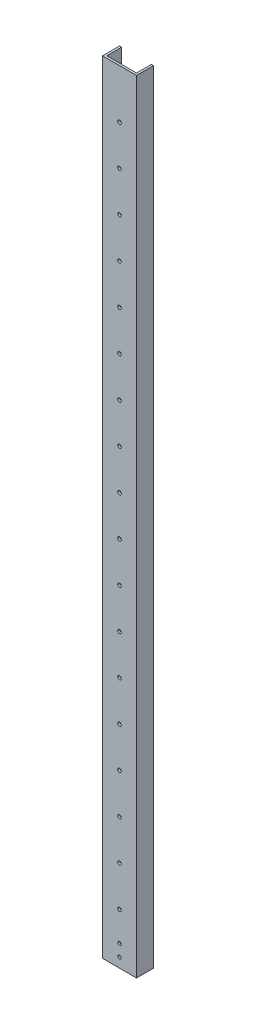
from build123d import *

# Parameters (mm, degrees)
BOSS_EXTRUDE1_DEPTH = 1168.4
CUT_EXTRUDE1_REACH  = 1171.78
SKETCH2_R           = 2.667
CUT_EXTRUDE2_REACH  = 1171.78
SKETCH3_R           = 2.5527


with BuildPart() as part:
    # Sketch1 → Boss-Extrude1 (new body)
    with BuildSketch(Plane(origin=(0, 0, 0), x_dir=(1, 0, 0), z_dir=(0, 1, 0))):
        Polygon((3.175, 3.175), (3.175, 25.4), (0, 25.4), (0, 0), (50.8, 0), (50.8, 25.4), (47.625, 25.4), (47.625, 3.175), align=None)
    extrude(amount=BOSS_EXTRUDE1_DEPTH)

    # Sketch2 → Cut-Extrude1 (cut, up to next)
    with BuildSketch(Plane.XY, mode=Mode.PRIVATE) as cut_extrude1_sk1:
        with Locations((25.4, 76.2)):
            Circle(SKETCH2_R)
    cut_extrude1_tool1 = extrude(cut_extrude1_sk1.sketch, amount=-CUT_EXTRUDE1_REACH, mode=Mode.PRIVATE) & part.part
    # Sketch2 → Cut-Extrude1 (cut, up to next)
    with BuildSketch(Plane.XY, mode=Mode.PRIVATE) as cut_extrude1_sk2:
        with Locations((25.4, 136.144)):
            Circle(SKETCH2_R)
    cut_extrude1_tool2 = extrude(cut_extrude1_sk2.sketch, amount=-CUT_EXTRUDE1_REACH, mode=Mode.PRIVATE) & part.part
    # Sketch2 → Cut-Extrude1 (cut, up to next)
    with BuildSketch(Plane.XY, mode=Mode.PRIVATE) as cut_extrude1_sk3:
        with Locations((25.4, 196.088)):
            Circle(SKETCH2_R)
    cut_extrude1_tool3 = extrude(cut_extrude1_sk3.sketch, amount=-CUT_EXTRUDE1_REACH, mode=Mode.PRIVATE) & part.part
    # Sketch2 → Cut-Extrude1 (cut, up to next)
    with BuildSketch(Plane.XY, mode=Mode.PRIVATE) as cut_extrude1_sk4:
        with Locations((25.4, 256.032)):
            Circle(SKETCH2_R)
    cut_extrude1_tool4 = extrude(cut_extrude1_sk4.sketch, amount=-CUT_EXTRUDE1_REACH, mode=Mode.PRIVATE) & part.part
    # Sketch2 → Cut-Extrude1 (cut, up to next)
    with BuildSketch(Plane.XY, mode=Mode.PRIVATE) as cut_extrude1_sk5:
        with Locations((25.4, 315.976)):
            Circle(SKETCH2_R)
    cut_extrude1_tool5 = extrude(cut_extrude1_sk5.sketch, amount=-CUT_EXTRUDE1_REACH, mode=Mode.PRIVATE) & part.part
    # Sketch2 → Cut-Extrude1 (cut, up to next)
    with BuildSketch(Plane.XY, mode=Mode.PRIVATE) as cut_extrude1_sk6:
        with Locations((25.4, 375.92)):
            Circle(SKETCH2_R)
    cut_extrude1_tool6 = extrude(cut_extrude1_sk6.sketch, amount=-CUT_EXTRUDE1_REACH, mode=Mode.PRIVATE) & part.part
    # Sketch2 → Cut-Extrude1 (cut, up to next)
    with BuildSketch(Plane.XY, mode=Mode.PRIVATE) as cut_extrude1_sk7:
        with Locations((25.4, 435.864)):
            Circle(SKETCH2_R)
    cut_extrude1_tool7 = extrude(cut_extrude1_sk7.sketch, amount=-CUT_EXTRUDE1_REACH, mode=Mode.PRIVATE) & part.part
    # Sketch2 → Cut-Extrude1 (cut, up to next)
    with BuildSketch(Plane.XY, mode=Mode.PRIVATE) as cut_extrude1_sk8:
        with Locations((25.4, 495.808)):
            Circle(SKETCH2_R)
    cut_extrude1_tool8 = extrude(cut_extrude1_sk8.sketch, amount=-CUT_EXTRUDE1_REACH, mode=Mode.PRIVATE) & part.part
    # Sketch2 → Cut-Extrude1 (cut, up to next)
    with BuildSketch(Plane.XY, mode=Mode.PRIVATE) as cut_extrude1_sk9:
        with Locations((25.4, 555.752)):
            Circle(SKETCH2_R)
    cut_extrude1_tool9 = extrude(cut_extrude1_sk9.sketch, amount=-CUT_EXTRUDE1_REACH, mode=Mode.PRIVATE) & part.part
    # Sketch2 → Cut-Extrude1 (cut, up to next)
    with BuildSketch(Plane.XY, mode=Mode.PRIVATE) as cut_extrude1_sk10:
        with Locations((25.4, 615.696)):
            Circle(SKETCH2_R)
    cut_extrude1_tool10 = extrude(cut_extrude1_sk10.sketch, amount=-CUT_EXTRUDE1_REACH, mode=Mode.PRIVATE) & part.part
    # Sketch2 → Cut-Extrude1 (cut, up to next)
    with BuildSketch(Plane.XY, mode=Mode.PRIVATE) as cut_extrude1_sk11:
        with Locations((25.4, 675.64)):
            Circle(SKETCH2_R)
    cut_extrude1_tool11 = extrude(cut_extrude1_sk11.sketch, amount=-CUT_EXTRUDE1_REACH, mode=Mode.PRIVATE) & part.part
    # Sketch2 → Cut-Extrude1 (cut, up to next)
    with BuildSketch(Plane.XY, mode=Mode.PRIVATE) as cut_extrude1_sk12:
        with Locations((25.4, 735.584)):
            Circle(SKETCH2_R)
    cut_extrude1_tool12 = extrude(cut_extrude1_sk12.sketch, amount=-CUT_EXTRUDE1_REACH, mode=Mode.PRIVATE) & part.part
    # Sketch2 → Cut-Extrude1 (cut, up to next)
    with BuildSketch(Plane.XY, mode=Mode.PRIVATE) as cut_extrude1_sk13:
        with Locations((25.4, 795.528)):
            Circle(SKETCH2_R)
    cut_extrude1_tool13 = extrude(cut_extrude1_sk13.sketch, amount=-CUT_EXTRUDE1_REACH, mode=Mode.PRIVATE) & part.part
    # Sketch2 → Cut-Extrude1 (cut, up to next)
    with BuildSketch(Plane.XY, mode=Mode.PRIVATE) as cut_extrude1_sk14:
        with Locations((25.4, 855.472)):
            Circle(SKETCH2_R)
    cut_extrude1_tool14 = extrude(cut_extrude1_sk14.sketch, amount=-CUT_EXTRUDE1_REACH, mode=Mode.PRIVATE) & part.part
    # Sketch2 → Cut-Extrude1 (cut, up to next)
    with BuildSketch(Plane.XY, mode=Mode.PRIVATE) as cut_extrude1_sk15:
        with Locations((25.4, 915.416)):
            Circle(SKETCH2_R)
    cut_extrude1_tool15 = extrude(cut_extrude1_sk15.sketch, amount=-CUT_EXTRUDE1_REACH, mode=Mode.PRIVATE) & part.part
    # Sketch2 → Cut-Extrude1 (cut, up to next)
    with BuildSketch(Plane.XY, mode=Mode.PRIVATE) as cut_extrude1_sk16:
        with Locations((25.4, 975.36)):
            Circle(SKETCH2_R)
    cut_extrude1_tool16 = extrude(cut_extrude1_sk16.sketch, amount=-CUT_EXTRUDE1_REACH, mode=Mode.PRIVATE) & part.part
    # Sketch2 → Cut-Extrude1 (cut, up to next)
    with BuildSketch(Plane.XY, mode=Mode.PRIVATE) as cut_extrude1_sk17:
        with Locations((25.4, 1035.304)):
            Circle(SKETCH2_R)
    cut_extrude1_tool17 = extrude(cut_extrude1_sk17.sketch, amount=-CUT_EXTRUDE1_REACH, mode=Mode.PRIVATE) & part.part
    # Sketch2 → Cut-Extrude1 (cut, up to next)
    with BuildSketch(Plane.XY, mode=Mode.PRIVATE) as cut_extrude1_sk18:
        with Locations((25.4, 1095.248)):
            Circle(SKETCH2_R)
    cut_extrude1_tool18 = extrude(cut_extrude1_sk18.sketch, amount=-CUT_EXTRUDE1_REACH, mode=Mode.PRIVATE) & part.part
    add(cut_extrude1_tool1.solids().sort_by_distance((25.4, 76.2, 0))[0], mode=Mode.SUBTRACT)
    add(cut_extrude1_tool2.solids().sort_by_distance((25.4, 136.144, 0))[0], mode=Mode.SUBTRACT)
    add(cut_extrude1_tool3.solids().sort_by_distance((25.4, 196.088, 0))[0], mode=Mode.SUBTRACT)
    add(cut_extrude1_tool4.solids().sort_by_distance((25.4, 256.032, 0))[0], mode=Mode.SUBTRACT)
    add(cut_extrude1_tool5.solids().sort_by_distance((25.4, 315.976, 0))[0], mode=Mode.SUBTRACT)
    add(cut_extrude1_tool6.solids().sort_by_distance((25.4, 375.92, 0))[0], mode=Mode.SUBTRACT)
    add(cut_extrude1_tool7.solids().sort_by_distance((25.4, 435.864, 0))[0], mode=Mode.SUBTRACT)
    add(cut_extrude1_tool8.solids().sort_by_distance((25.4, 495.808, 0))[0], mode=Mode.SUBTRACT)
    add(cut_extrude1_tool9.solids().sort_by_distance((25.4, 555.752, 0))[0], mode=Mode.SUBTRACT)
    add(cut_extrude1_tool10.solids().sort_by_distance((25.4, 615.696, 0))[0], mode=Mode.SUBTRACT)
    add(cut_extrude1_tool11.solids().sort_by_distance((25.4, 675.64, 0))[0], mode=Mode.SUBTRACT)
    add(cut_extrude1_tool12.solids().sort_by_distance((25.4, 735.584, 0))[0], mode=Mode.SUBTRACT)
    add(cut_extrude1_tool13.solids().sort_by_distance((25.4, 795.528, 0))[0], mode=Mode.SUBTRACT)
    add(cut_extrude1_tool14.solids().sort_by_distance((25.4, 855.472, 0))[0], mode=Mode.SUBTRACT)
    add(cut_extrude1_tool15.solids().sort_by_distance((25.4, 915.416, 0))[0], mode=Mode.SUBTRACT)
    add(cut_extrude1_tool16.solids().sort_by_distance((25.4, 975.36, 0))[0], mode=Mode.SUBTRACT)
    add(cut_extrude1_tool17.solids().sort_by_distance((25.4, 1035.304, 0))[0], mode=Mode.SUBTRACT)
    add(cut_extrude1_tool18.solids().sort_by_distance((25.4, 1095.248, 0))[0], mode=Mode.SUBTRACT)

    # Sketch3 → Cut-Extrude2 (cut, up to next)
    with BuildSketch(Plane.XY, mode=Mode.PRIVATE) as cut_extrude2_sk1:
        with Locations((25.4, 32.131)):
            Circle(SKETCH3_R)
    cut_extrude2_tool1 = extrude(cut_extrude2_sk1.sketch, amount=-CUT_EXTRUDE2_REACH, mode=Mode.PRIVATE) & part.part
    # Sketch3 → Cut-Extrude2 (cut, up to next)
    with BuildSketch(Plane.XY, mode=Mode.PRIVATE) as cut_extrude2_sk2:
        with Locations((25.4, 14.2875)):
            Circle(SKETCH3_R)
    cut_extrude2_tool2 = extrude(cut_extrude2_sk2.sketch, amount=-CUT_EXTRUDE2_REACH, mode=Mode.PRIVATE) & part.part
    add(cut_extrude2_tool1.solids().sort_by_distance((25.4, 32.131, 0))[0], mode=Mode.SUBTRACT)
    add(cut_extrude2_tool2.solids().sort_by_distance((25.4, 14.2875, 0))[0], mode=Mode.SUBTRACT)


solid = part.part
